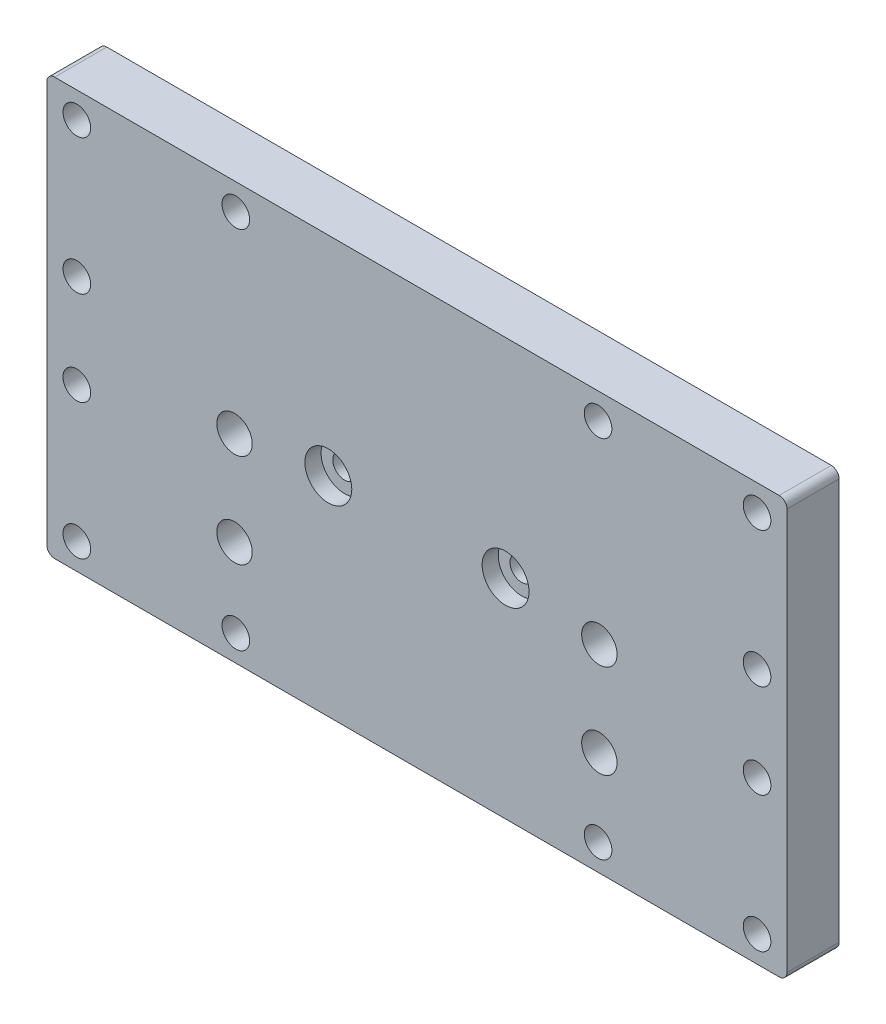
from build123d import *

# Parameters (mm, degrees)
SKETCH1_W                                        = 142
SKETCH1_H                                        = 80
BOSS_EXTRUDE1_DEPTH                              = 5
M5_CLEARANCE_HOLE1_D                             = 5.3
MIRROR2_COPY_1_D                                 = 5.3
MIRROR2_COPY_2_D                                 = 5.3
CBORE_FOR_M4_PAN_HEAD_MACHINE_SCREW1_D           = 4.5
CBORE_FOR_M4_PAN_HEAD_MACHINE_SCREW1_CBORE_D     = 9
CBORE_FOR_M4_PAN_HEAD_MACHINE_SCREW1_CBORE_DEPTH = 3.1
M8X1_25_TAPPED_HOLE1_D                           = 6.8
FILLET1_R                                        = 1.5


with BuildPart() as part:
    # Sketch1 → Boss-Extrude1 (new, symmetric)
    with BuildSketch(Plane.XY):
        Rectangle(SKETCH1_W, SKETCH1_H)
    extrude(amount=BOSS_EXTRUDE1_DEPTH, both=True)

    # M5 Clearance Hole1 (through all)
    with Locations(Plane.XY.offset(5)):
        with Locations((-65.25, 35), (-34.75, 35), (-65.25, 9)):
            m5_clearance_hole1 = Hole(M5_CLEARANCE_HOLE1_D / 2)

    # Mirror1: M5 Clearance Hole1 across plane
    add(m5_clearance_hole1.mirror(Plane(origin=(0, 0, 0), x_dir=(0, 0, 1), z_dir=(1, 0, 0))), mode=Mode.SUBTRACT)

    # Mirror2 copy 1 (through all)
    with Locations(Plane(origin=(0, 0, 5), x_dir=(-1, 0, 0), z_dir=(0, 0, 1))):
        with Locations((-65.25, 35), (-34.75, 35), (-65.25, 9)):
            Hole(MIRROR2_COPY_1_D / 2)

    # Mirror2 copy 2 (through all)
    with Locations(Plane.XY.offset(5)):
        with Locations((-65.25, -35), (-34.75, -35), (-65.25, -9)):
            Hole(MIRROR2_COPY_2_D / 2)

    # CBORE for M4 Pan Head Machine Screw1 (through all)
    with Locations(Plane(origin=(-50.308370618, 7.533390419, 5), x_dir=(1, 0, 0), z_dir=(0, 0, 1))):
        with Locations((33.308370618, -7.533390419), (67.308370618, -7.533390419)):
            CounterBoreHole(CBORE_FOR_M4_PAN_HEAD_MACHINE_SCREW1_D / 2, CBORE_FOR_M4_PAN_HEAD_MACHINE_SCREW1_CBORE_D / 2, CBORE_FOR_M4_PAN_HEAD_MACHINE_SCREW1_CBORE_DEPTH)

    # M8x1.25 Tapped Hole1 (through all)
    with Locations(Plane.XY.offset(5)):
        with Locations((-35, -2), (35, -2), (35, -20), (-35, -20)):
            Hole(M8X1_25_TAPPED_HOLE1_D / 2)

    # Fillet1
    fillet1_edges = [part.edges().sort_by_distance(p)[0] for p in [
        (-71, -40, 0),
        (71, -40, 0),
        (71, 40, 0),
        (-71, 40, 0),
    ]]
    fillet(fillet1_edges, radius=FILLET1_R)


solid = part.part
